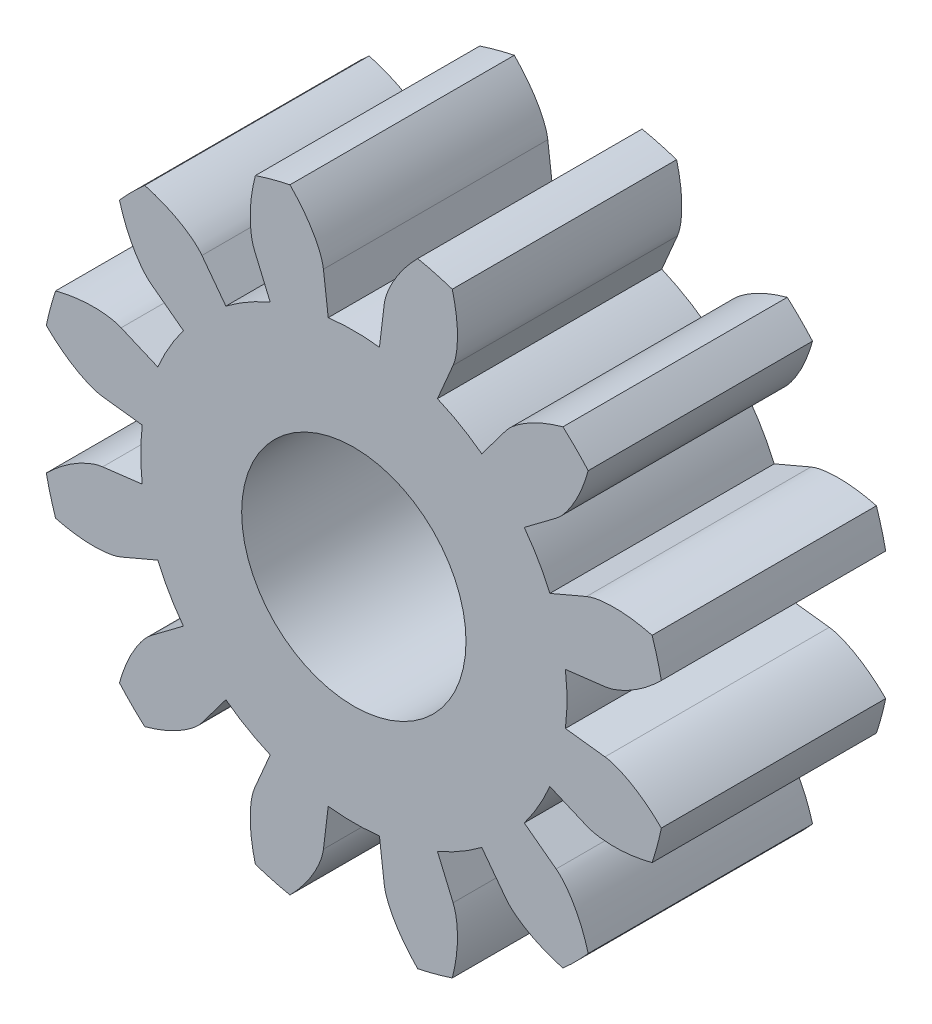
from build123d import *

# Parameters (mm, degrees)
SKETCH_1_R               = 1.4
SKETCH_1_R_2             = 0.5
EXTRUDE_1_DEPTH          = 1
CUT_EXTRUDE_1_DEPTH      = 3.218107301
PATTERN_CIRCULAR_1_COUNT = 12
PATTERN_CIRCULAR_1_ANGLE = 330


with BuildPart() as part:
    # 草图1 → 凸台-拉伸1 (new body)
    with BuildSketch(Plane.XY):
        Circle(SKETCH_1_R)
        Circle(SKETCH_1_R_2, mode=Mode.SUBTRACT)
    extrude(amount=EXTRUDE_1_DEPTH)

    # 草图1<3> → 切除-拉伸1 (cut, through all)
    with BuildSketch(Plane.XY):
        with BuildLine():
            Line((1.11946981, 0.135422832), (0.943124287, 0.114090224))
            ThreePointArc((0.943124287, 0.114090224), (0.948279514, 0.057148611), (0.95, 0))
            ThreePointArc((0.95, 0), (0.948279514, -0.057148611), (0.943124287, -0.114090224))
            Line((0.943124287, -0.114090224), (1.11946981, -0.135422832))
            add(Edge.make_bspline(
                [(1.11946981, -0.135422832), (1.128003225, -0.136455124), (1.151602744, -0.141109468), (1.194919759, -0.156967361), (1.260546906, -0.191853213), (1.313246813, -0.231377006), (1.350571488, -0.264875278), (1.370742128, -0.284720947)],
                knots=[0, 0, 0, 0, 0, 0.005604068, 0.015718248, 0.029959916, 0.048452588, 0.048452588, 0.048452588, 0.048452588, 0.048452588], degree=4))
            ThreePointArc((1.370742128, -0.284720947), (1.392666324, -0.143110133), (1.4, 0))
            ThreePointArc((1.4, 0), (1.392666324, 0.143110133), (1.370742128, 0.284720947))
            add(Edge.make_bspline(
                [(1.11946981, 0.135422832), (1.128003225, 0.136455124), (1.151602744, 0.141109468), (1.194919759, 0.156967361), (1.260546906, 0.191853213), (1.313246813, 0.231377006), (1.350571488, 0.264875278), (1.370742128, 0.284720947)],
                knots=[0, 0, 0, 0, 0, 0.005604068, 0.015718248, 0.029959916, 0.048452588, 0.048452588, 0.048452588, 0.048452588, 0.048452588], degree=4))
        make_face()
    cut_extrude_1 = extrude(amount=CUT_EXTRUDE_1_DEPTH, mode=Mode.SUBTRACT)

    # 阵列(圆周)1: 切除-拉伸1 ×12 about axis
    pattern_circular_1_axis = Axis((0, 0, 1), (0, 0, 1))
    for i in range(1, PATTERN_CIRCULAR_1_COUNT):
        add(cut_extrude_1.rotate(pattern_circular_1_axis, i * PATTERN_CIRCULAR_1_ANGLE / (PATTERN_CIRCULAR_1_COUNT - 1)), mode=Mode.SUBTRACT)


solid = part.part
